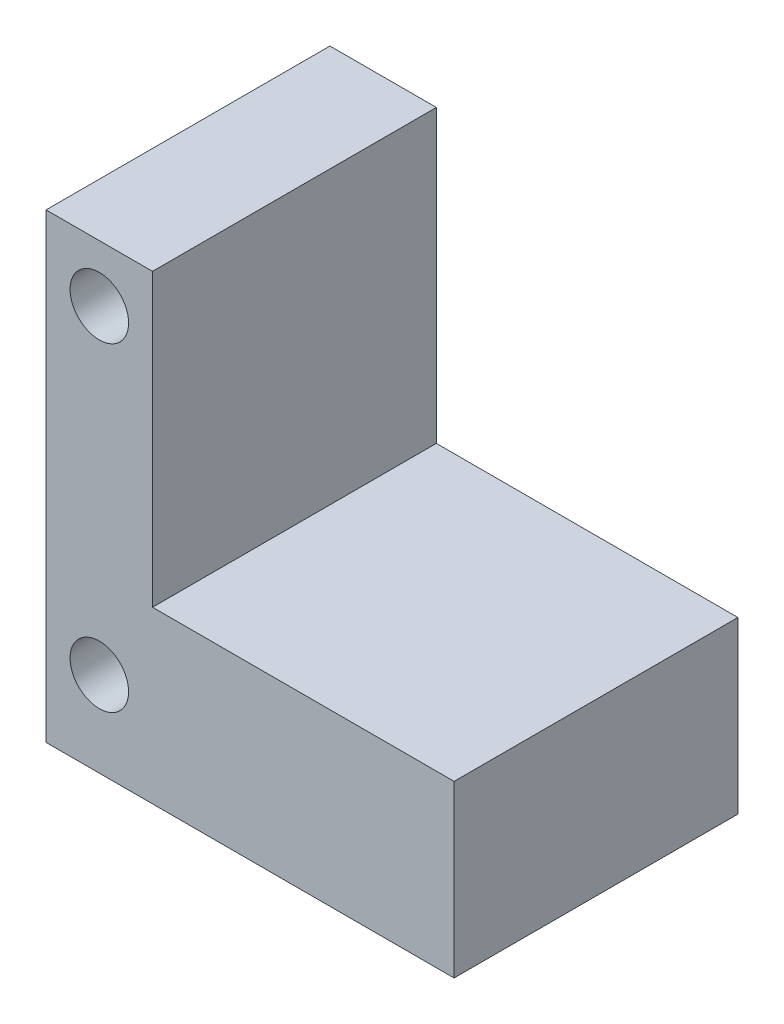
from build123d import *

# Parameters (mm, degrees)
SKETCH1_R           = 1.65
BOSS_EXTRUDE1_DEPTH = 16


with BuildPart() as part:
    # Sketch1 → Boss-Extrude1 (new body)
    with BuildSketch(Plane.XY.offset(44.914307383)):
        Polygon((-76, -29.396728555), (-99, -29.396728555), (-99, -3.396728555), (-93, -3.396728555), (-93, -19.796728555), (-76, -19.796728555), align=None)
        with Locations((-96.000000001, -24.59672823)):
            Circle(SKETCH1_R, mode=Mode.SUBTRACT)
        with Locations((-96.000000001, -6.59672823)):
            Circle(SKETCH1_R, mode=Mode.SUBTRACT)
    extrude(amount=-BOSS_EXTRUDE1_DEPTH)


solid = part.part
